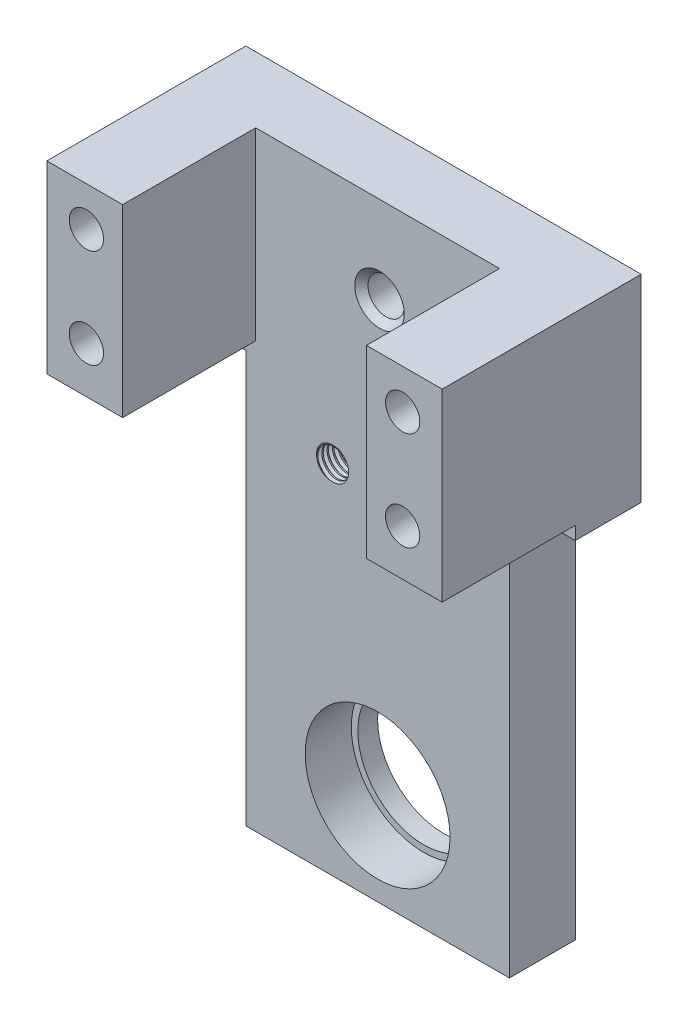
from build123d import *

# Parameters (mm, degrees)
SKIZZE1_W                            = 40
SKIZZE1_H                            = 110
AUFSATZ_LINEAR_AUSTRAGEN1_DEPTH      = 10
SKIZZE2_W                            = 40
SKIZZE2_H                            = 0.01
SCHNITT_LINEAR_AUSTRAGEN1_DEPTH      = 0.1
SCHNITT_LINEAR_AUSTRAGEN2_DEPTH      = 7
SCHNITT_LINEAR_AUSTRAGEN2_DEPTH_BACK = 11
SKIZZE3_R                            = 10
SKIZZE8_W                            = 60
SKIZZE8_H                            = 10
AUFSATZ_LINEAR_AUSTRAGEN2_DEPTH      = 30
SKIZZE5_R                            = 2.7575
SCHNITT_LINEAR_AUSTRAGEN4_DEPTH      = 7.5
SKIZZE6_R                            = 11.35
SCHNITT_LINEAR_AUSTRAGEN5_DEPTH      = 2.5
FASE1_SIZE                           = 1
SKIZZE7_R                            = 11
SCHNITT_LINEAR_AUSTRAGEN7_DEPTH      = 7
SKIZZE9_W                            = 11.5
SKIZZE9_H                            = 28
AUFSATZ_LINEAR_AUSTRAGEN3_DEPTH      = 20.2
SKIZZE10_W                           = 40
SKIZZE10_H                           = 10
SCHNITT_LINEAR_AUSTRAGEN8_DEPTH      = 17.5
SKIZZE11_R                           = 4.5
SCHNITT_LINEAR_AUSTRAGEN9_DEPTH      = 19
SKIZZE12_R                           = 2.6
SCHNITT_LINEAR_AUSTRAGEN10_DEPTH     = 17.5
SKIZZE13_R                           = 2.25
SCHNITT_LINEAR_AUSTRAGEN11_DEPTH     = 18
GEWINDE1_PITCH                       = 0.8
GEWINDE2_PITCH                       = 0.8


with BuildPart() as part:
    # Skizze1 → Aufsatz-Linear austragen1 (new body)
    with BuildSketch(Plane.XY):
        with Locations((20, 55)):
            Rectangle(SKIZZE1_W, SKIZZE1_H)
    extrude(amount=AUFSATZ_LINEAR_AUSTRAGEN1_DEPTH)

    # Skizze2 → Schnitt-Linear austragen1 (cut)
    with BuildSketch(Plane(origin=(0, 0, 0), x_dir=(-1, 0, 0), z_dir=(0, 0, -1))):
        with Locations((-20, 10.005)):
            Rectangle(SKIZZE2_W, SKIZZE2_H)
    extrude(amount=-SCHNITT_LINEAR_AUSTRAGEN1_DEPTH, mode=Mode.SUBTRACT)

    # Skizze3 → Schnitt-Linear austragen2 (cut, two sides: drawn at the far end of the back side and taken through both)
    with BuildSketch(Plane(origin=(0, 0, 0.1), x_dir=(-1, 0, 0), z_dir=(0, 0, -1)).offset(-SCHNITT_LINEAR_AUSTRAGEN2_DEPTH_BACK)):
        with Locations((-20, 31.5)):
            Circle(SKIZZE3_R)
    extrude(amount=SCHNITT_LINEAR_AUSTRAGEN2_DEPTH + SCHNITT_LINEAR_AUSTRAGEN2_DEPTH_BACK, mode=Mode.SUBTRACT)

    # Skizze8 → Aufsatz-Linear austragen2 (add)
    with BuildSketch(Plane(origin=(0, 110, 0), x_dir=(1, 0, 0), z_dir=(0, 1, 0))):
        with Locations((20, -5)):
            Rectangle(SKIZZE8_W, SKIZZE8_H)
    extrude(amount=-AUFSATZ_LINEAR_AUSTRAGEN2_DEPTH)

    # Skizze5 → Schnitt-Linear austragen4 (cut)
    with BuildSketch(Plane.XY.offset(10)):
        with Locations((20.290455997, 96.8)):
            Circle(SKIZZE5_R)
    extrude(amount=-SCHNITT_LINEAR_AUSTRAGEN4_DEPTH, mode=Mode.SUBTRACT)

    # Skizze6 → Schnitt-Linear austragen5 (cut)
    with BuildSketch(Plane.XY.offset(2.5)):
        with Locations((20.290455997, 96.8)):
            Circle(SKIZZE6_R)
    extrude(amount=-SCHNITT_LINEAR_AUSTRAGEN5_DEPTH, mode=Mode.SUBTRACT)

    # Fase1
    fase1_edges = [part.edges().sort_by_distance(p)[0] for p in [
        (30, 31.5, 10),
        (17.532955997, 96.8, 10),
    ]]
    chamfer(fase1_edges, length=FASE1_SIZE)

    # Skizze7 → Schnitt-Linear austragen7 (cut)
    with BuildSketch(Plane.XY.offset(10)):
        with Locations((20, 31.5)):
            Circle(SKIZZE7_R)
    extrude(amount=-SCHNITT_LINEAR_AUSTRAGEN7_DEPTH, mode=Mode.SUBTRACT)

    # Skizze9 → Aufsatz-Linear austragen3 (add)
    with BuildSketch(Plane.XY.offset(10)):
        with Locations((44.25, 96)):
            Rectangle(SKIZZE9_W, SKIZZE9_H)
        with Locations((-4.25, 96)):
            Rectangle(SKIZZE9_W, SKIZZE9_H)
    extrude(amount=AUFSATZ_LINEAR_AUSTRAGEN3_DEPTH)

    # Skizze10 → Schnitt-Linear austragen8 (cut)
    with BuildSketch(Plane.XZ):
        with Locations((20, 5)):
            Rectangle(SKIZZE10_W, SKIZZE10_H)
    extrude(amount=-SCHNITT_LINEAR_AUSTRAGEN8_DEPTH, mode=Mode.SUBTRACT)

    # Skizze11 → Schnitt-Linear austragen9 (cut)
    with BuildSketch(Plane(origin=(0, 0, 0), x_dir=(-1, 0, 0), z_dir=(0, 0, -1))):
        with Locations((-44, 104)):
            Circle(SKIZZE11_R)
        with Locations((-44, 89)):
            Circle(SKIZZE11_R)
        with Locations((4, 104)):
            Circle(SKIZZE11_R)
        with Locations((4, 89)):
            Circle(SKIZZE11_R)
    extrude(amount=-SCHNITT_LINEAR_AUSTRAGEN9_DEPTH, mode=Mode.SUBTRACT)

    # Skizze12 → Schnitt-Linear austragen10 (cut)
    with BuildSketch(Plane(origin=(0, 0, 19), x_dir=(-1, 0, 0), z_dir=(0, 0, -1))):
        with Locations((-44, 104)):
            Circle(SKIZZE12_R)
        with Locations((4, 104)):
            Circle(SKIZZE12_R)
        with Locations((4, 89)):
            Circle(SKIZZE12_R)
        with Locations((-44, 89)):
            Circle(SKIZZE12_R)
    extrude(amount=-SCHNITT_LINEAR_AUSTRAGEN10_DEPTH, mode=Mode.SUBTRACT)

    # Skizze13 → Schnitt-Linear austragen11 (cut)
    with BuildSketch(Plane(origin=(0, 0, 0), x_dir=(-1, 0, 0), z_dir=(0, 0, -1))):
        with Locations((-27, 71.55)):
            Circle(SKIZZE13_R)
        with Locations((-13, 71.55)):
            Circle(SKIZZE13_R)
    extrude(amount=-SCHNITT_LINEAR_AUSTRAGEN11_DEPTH, mode=Mode.SUBTRACT)

    # Gewinde1: the profile of Gewindeprofil1 profile screwed along a right-hand helix of 12.5 turns, 8 arcs to a turn; built about Z, then put on its axis
    gewinde1_z = Axis((0, 0, 0), (0, 0, 1))
    gewinde1_corners = [(2.2497, 0, -0.000173205), (2.6830127, 0, 0.249999999), (2.6830127, 0, 0.349999999), (2.2497, 0, 0.600173203)]
    with BuildLine(mode=Mode.PRIVATE) as gewinde1_profile:
        Line(gewinde1_corners[0], gewinde1_corners[1])
        Line(gewinde1_corners[1], gewinde1_corners[2])
        Line(gewinde1_corners[2], gewinde1_corners[3])
        Line(gewinde1_corners[3], gewinde1_corners[0])
    gewinde1_cap = Face(gewinde1_profile.wire())
    gewinde1_turn_angles = [0, 22.5, 45, 67.5, 90, 112.5, 135, 157.5, 180, 202.5, 225, 247.5, 270, 292.5, 315, 337.5, 360]
    gewinde1_turn_weights = [1, 0.9238795325112867, 1, 0.9238795325112867, 1, 0.9238795325112867, 1, 0.9238795325112867, 1, 0.9238795325112867, 1, 0.9238795325112867, 1, 0.9238795325112867, 1, 0.9238795325112867, 1]
    gewinde1_turn_rails = [Edge.make_bspline([Vector(p[0], p[1], 0).rotate(gewinde1_z, gewinde1_turn_angles[k]) / gewinde1_turn_weights[k] + Vector(0, 0, p[2] + GEWINDE1_PITCH * gewinde1_turn_angles[k] / 360) for k in range(17)], [0, 0, 0, 1, 1, 2, 2, 3, 3, 4, 4, 5, 5, 6, 6, 7, 7, 8, 8, 8], 2, gewinde1_turn_weights) for p in gewinde1_corners]
    gewinde1_turn_sides = [Face.make_surface_from_curves(gewinde1_turn_rails[p[0]], gewinde1_turn_rails[p[1]]) for p in [(0, 1), (1, 2), (2, 3), (3, 0)]]
    gewinde1_last_angles = [4320, 4342.5, 4365, 4387.5, 4410, 4432.5, 4455, 4477.5, 4500]
    gewinde1_last_weights = [1, 0.9238795325112867, 1, 0.9238795325112867, 1, 0.9238795325112867, 1, 0.9238795325112867, 1]
    gewinde1_last_rails = [Edge.make_bspline([Vector(p[0], p[1], 0).rotate(gewinde1_z, gewinde1_last_angles[k]) / gewinde1_last_weights[k] + Vector(0, 0, p[2] + GEWINDE1_PITCH * gewinde1_last_angles[k] / 360) for k in range(9)], [0, 0, 0, 1, 1, 2, 2, 3, 3, 4, 4, 4], 2, gewinde1_last_weights) for p in gewinde1_corners]
    gewinde1_last_sides = [Face.make_surface_from_curves(gewinde1_last_rails[p[0]], gewinde1_last_rails[p[1]]) for p in [(0, 1), (1, 2), (2, 3), (3, 0)]]
    gewinde1 = Plane(origin=(27, 71.55, 0), x_dir=(1, 0, 0), z_dir=(0, 0, 1)) * Solid(Shell([*[p.moved(Location((0, 0, GEWINDE1_PITCH * i))) for i in range(12) for p in gewinde1_turn_sides], *gewinde1_last_sides, gewinde1_cap, gewinde1_cap.rotate(gewinde1_z, 4500).moved(Location((0, 0, GEWINDE1_PITCH * 4500 / 360)))]))
    add(gewinde1, mode=Mode.SUBTRACT)

    # Gewinde2: the profile of Gewindeprofil2 profile screwed along a right-hand helix of 12.5 turns, 8 arcs to a turn; built about Z, then put on its axis
    gewinde2_z = Axis((0, 0, 0), (0, 0, 1))
    gewinde2_corners = [(2.2497, 0, -0.000173205), (2.6830127, 0, 0.249999999), (2.6830127, 0, 0.349999999), (2.2497, 0, 0.600173203)]
    with BuildLine(mode=Mode.PRIVATE) as gewinde2_profile:
        Line(gewinde2_corners[0], gewinde2_corners[1])
        Line(gewinde2_corners[1], gewinde2_corners[2])
        Line(gewinde2_corners[2], gewinde2_corners[3])
        Line(gewinde2_corners[3], gewinde2_corners[0])
    gewinde2_cap = Face(gewinde2_profile.wire())
    gewinde2_turn_angles = [0, 22.5, 45, 67.5, 90, 112.5, 135, 157.5, 180, 202.5, 225, 247.5, 270, 292.5, 315, 337.5, 360]
    gewinde2_turn_weights = [1, 0.9238795325112867, 1, 0.9238795325112867, 1, 0.9238795325112867, 1, 0.9238795325112867, 1, 0.9238795325112867, 1, 0.9238795325112867, 1, 0.9238795325112867, 1, 0.9238795325112867, 1]
    gewinde2_turn_rails = [Edge.make_bspline([Vector(p[0], p[1], 0).rotate(gewinde2_z, gewinde2_turn_angles[k]) / gewinde2_turn_weights[k] + Vector(0, 0, p[2] + GEWINDE2_PITCH * gewinde2_turn_angles[k] / 360) for k in range(17)], [0, 0, 0, 1, 1, 2, 2, 3, 3, 4, 4, 5, 5, 6, 6, 7, 7, 8, 8, 8], 2, gewinde2_turn_weights) for p in gewinde2_corners]
    gewinde2_turn_sides = [Face.make_surface_from_curves(gewinde2_turn_rails[p[0]], gewinde2_turn_rails[p[1]]) for p in [(0, 1), (1, 2), (2, 3), (3, 0)]]
    gewinde2_last_angles = [4320, 4342.5, 4365, 4387.5, 4410, 4432.5, 4455, 4477.5, 4500]
    gewinde2_last_weights = [1, 0.9238795325112867, 1, 0.9238795325112867, 1, 0.9238795325112867, 1, 0.9238795325112867, 1]
    gewinde2_last_rails = [Edge.make_bspline([Vector(p[0], p[1], 0).rotate(gewinde2_z, gewinde2_last_angles[k]) / gewinde2_last_weights[k] + Vector(0, 0, p[2] + GEWINDE2_PITCH * gewinde2_last_angles[k] / 360) for k in range(9)], [0, 0, 0, 1, 1, 2, 2, 3, 3, 4, 4, 4], 2, gewinde2_last_weights) for p in gewinde2_corners]
    gewinde2_last_sides = [Face.make_surface_from_curves(gewinde2_last_rails[p[0]], gewinde2_last_rails[p[1]]) for p in [(0, 1), (1, 2), (2, 3), (3, 0)]]
    gewinde2 = Plane(origin=(13, 71.55, 0), x_dir=(1, 0, 0), z_dir=(0, 0, 1)) * Solid(Shell([*[p.moved(Location((0, 0, GEWINDE2_PITCH * i))) for i in range(12) for p in gewinde2_turn_sides], *gewinde2_last_sides, gewinde2_cap, gewinde2_cap.rotate(gewinde2_z, 4500).moved(Location((0, 0, GEWINDE2_PITCH * 4500 / 360)))]))
    add(gewinde2, mode=Mode.SUBTRACT)


solid = part.part
